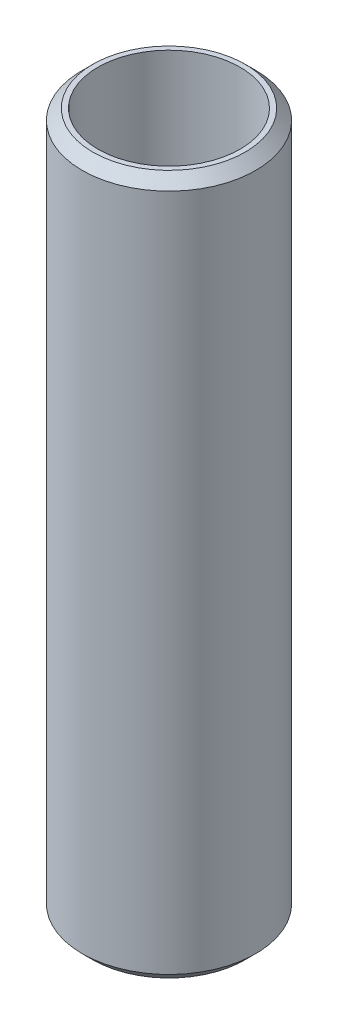
from build123d import *

# Parameters (mm, degrees)
SKETCH1_R           = 47.5
BOSS_EXTRUDE1_DEPTH = 383.107736659
SKETCH2_R           = 38.933810987
CUT_EXTRUDE1_DEPTH  = 389.952487957
CHAMFER1_SIZE       = 5.777580299


with BuildPart() as part:
    # Sketch1 → Boss-Extrude1 (new body)
    with BuildSketch(Plane(origin=(0, 0, 0), x_dir=(1, 0, 0), z_dir=(0, 1, 0))):
        Circle(SKETCH1_R)
    extrude(amount=BOSS_EXTRUDE1_DEPTH)

    # Sketch2 → Cut-Extrude1 (cut, through all)
    with BuildSketch(Plane(origin=(0, 0, 0), x_dir=(1, 0, 0), z_dir=(0, 1, 0))):
        Circle(SKETCH2_R)
    extrude(amount=CUT_EXTRUDE1_DEPTH, mode=Mode.SUBTRACT)

    # Chamfer1
    chamfer1_edges = [part.edges().sort_by_distance(p)[0] for p in [
        (-47.5, 383.107736659, 0),
        (-47.5, 0, 0),
    ]]
    chamfer(chamfer1_edges, length=CHAMFER1_SIZE)


solid = part.part
